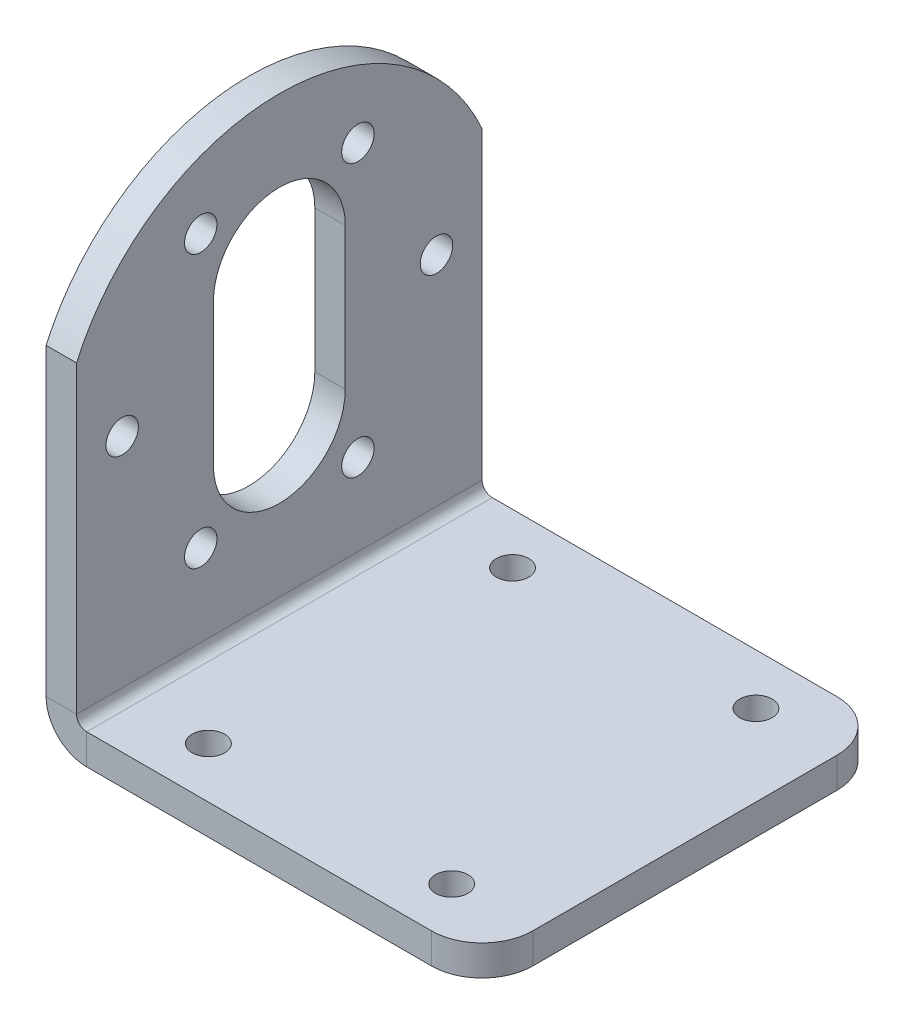
from build123d import *

# Parameters (mm, degrees)
SM_BASE_FLANGE_1_DEPTH      = 40
CUT_EXTRUDE_3_DEPTH         = 10
CUT_EXTRUDE_1_DEPTH         = 74.382559236
SKETCH_7_R                  = 1.6
CUT_EXTRUDE_2_DEPTH         = 74.382559236
SKETCH_9_R                  = 1.6
CUT_EXTRUDE_4_DEPTH         = 74.545904033
PATTERN_LINEAR_1_COUNT      = 2
PATTERN_LINEAR_1_PITCH      = 30
PATTERN_LINEAR_1_COUNT_DIR2 = 2
PATTERN_LINEAR_1_PITCH_DIR2 = 24
FILLET_1_R                  = 5


# Sheet-metal steps are written as plain solids
with BuildPart() as part:
    # Sketch 1 → 基材-凸緣1 (new body)
    with BuildSketch(Plane.XY):
        with BuildLine():
            Line((40, 0), (1, 0))
            ThreePointArc((1, 0), (0.292893219, 0.292893219), (0, 1))
            Line((0, 1), (0, 44))
            Line((0, 44), (-3, 44))
            Line((-3, 44), (-3, 1))
            ThreePointArc((-3, 1), (-1.828427125, -1.828427125), (1, -3))
            Line((1, -3), (40, -3))
            Line((40, -3), (40, 0))
        make_face()
    extrude(amount=SM_BASE_FLANGE_1_DEPTH)

    # 草圖8 → 除料-伸長3 (cut)
    with BuildSketch(Plane.ZY.offset(3)):
        with BuildLine():
            Line((0, 44), (0, 31.002788981))
            ThreePointArc((0, 31.002788981), (8.073899482, 40.465261916), (20, 44))
            Line((20, 44), (0, 44))
        make_face()
        with BuildLine():
            ThreePointArc((20, 44), (31.926100518, 40.465261916), (40, 31.002788981))
            Line((40, 31.002788981), (40, 44))
            Line((40, 44), (20, 44))
        make_face()
    extrude(amount=-CUT_EXTRUDE_3_DEPTH, mode=Mode.SUBTRACT)

    # 草圖6 → 除料-伸長1 (cut, through all)
    with BuildSketch(Plane.ZY.offset(3)):
        with BuildLine():
            Line((26.5, 29.5), (26.5, 15.5))
            ThreePointArc((26.5, 15.5), (20, 9), (13.5, 15.5))
            Line((13.5, 15.5), (13.5, 29.5))
            ThreePointArc((13.5, 29.5), (20, 36), (26.5, 29.5))
        make_face()
    extrude(amount=-CUT_EXTRUDE_1_DEPTH, mode=Mode.SUBTRACT)

    # 草圖7 → 除料-伸長2 (cut, through all)
    with BuildSketch(Plane.ZY.offset(3)):
        with Locations((4.5, 22.5)):
            Circle(SKETCH_7_R)
        with Locations((12.25, 9.076606241)):
            Circle(SKETCH_7_R)
        with Locations((27.75, 9.076606241)):
            Circle(SKETCH_7_R)
        with Locations((35.5, 22.5)):
            Circle(SKETCH_7_R)
        with Locations((27.75, 35.923393759)):
            Circle(SKETCH_7_R)
        with Locations((12.25, 35.923393759)):
            Circle(SKETCH_7_R)
    extrude(amount=-CUT_EXTRUDE_2_DEPTH, mode=Mode.SUBTRACT)

    # 草圖9 → 除料-伸長4 (cut, through all)
    with BuildSketch(Plane.XZ.offset(3)):
        with Locations(Location((32, 35, 0), (0, 0, 270))):
            Circle(SKETCH_9_R)
    cut_extrude_4 = extrude(amount=-CUT_EXTRUDE_4_DEPTH, mode=Mode.SUBTRACT)

    # 直線複製排列1: Cut-Extrude 4 2 × 2
    with Locations(*[(-j * PATTERN_LINEAR_1_PITCH_DIR2, 0, -i * PATTERN_LINEAR_1_PITCH) for i in range(PATTERN_LINEAR_1_COUNT) for j in range(PATTERN_LINEAR_1_COUNT_DIR2) if (i, j) != (0, 0)]):
        add(cut_extrude_4, mode=Mode.SUBTRACT)

    # 圓角1
    fillet_1_edges = [part.edges().sort_by_distance(p)[0] for p in [
        (40, -1.5, 40),
        (40, -1.5, 0),
    ]]
    fillet(fillet_1_edges, radius=FILLET_1_R)


solid = part.part
